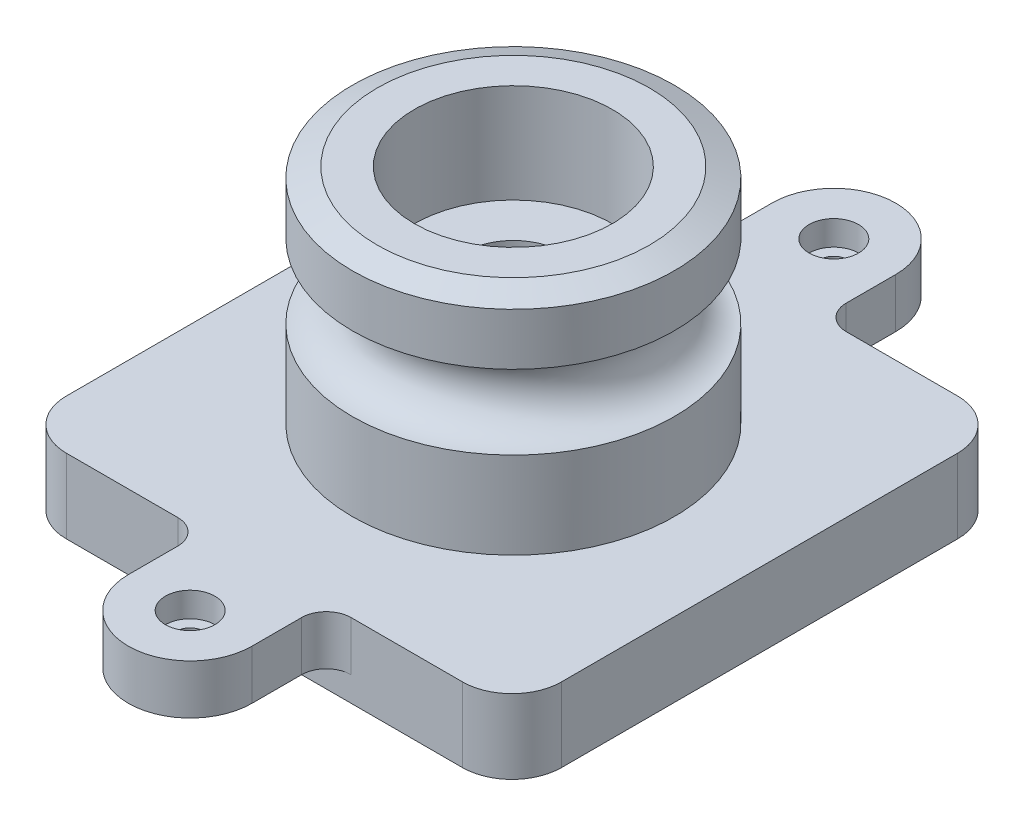
from build123d import *

# Parameters (mm, degrees)
SKETCH1_W                                    = 100
SKETCH1_H                                    = 100
BOSS_EXTRUDE1_DEPTH                          = 15
BOSS_EXTRUDE2_DEPTH                          = 10
CBORE_FOR_M5_HEX_HEAD_CAP_SCREW1_D           = 5.5
CBORE_FOR_M5_HEX_HEAD_CAP_SCREW1_CBORE_D     = 10
CBORE_FOR_M5_HEX_HEAD_CAP_SCREW1_CBORE_DEPTH = 5
FILLET1_R                                    = 5
FILLET2_R                                    = 10
CBORE_FOR_M36_HEX_HEAD_BOLT3_D               = 20
CBORE_FOR_M36_HEX_HEAD_BOLT3_CBORE_D         = 40
CBORE_FOR_M36_HEX_HEAD_BOLT3_CBORE_DEPTH     = 20
CHAMFER1_SIZE                                = 2
CHAMFER1_SIZE2                               = 5


with BuildPart() as part:
    # Sketch1 → Boss-Extrude1 (new body)
    with BuildSketch(Plane(origin=(0, 0, 0), x_dir=(1, 0, 0), z_dir=(0, 1, 0))):
        with Locations((50, 50)):
            Rectangle(SKETCH1_W, SKETCH1_H)
    extrude(amount=BOSS_EXTRUDE1_DEPTH)

    # Sketch3 → Boss-Extrude2 (add)
    with BuildSketch(Plane(origin=(0, 15, 0), x_dir=(1, 0, 0), z_dir=(0, 1, 0))):
        with BuildLine():
            Line((37.5, 100), (37.5, 115))
            ThreePointArc((37.5, 115), (50, 127.5), (62.5, 115))
            Line((62.5, 115), (62.5, 100))
            Line((62.5, 100), (37.5, 100))
        make_face()
        with BuildLine():
            Line((62.5, 0), (62.5, -15))
            ThreePointArc((62.5, -15), (50, -27.5), (37.5, -15))
            Line((37.5, -15), (37.5, 0))
            Line((37.5, 0), (62.5, 0))
        make_face()
    extrude(amount=-BOSS_EXTRUDE2_DEPTH)

    # CBORE for M5 Hex Head Cap Screw1 (through all)
    with Locations(Plane(origin=(0, 15, 0), x_dir=(1, 0, 0), z_dir=(0, 1, 0))):
        with Locations((50, 115), (50, -15)):
            CounterBoreHole(CBORE_FOR_M5_HEX_HEAD_CAP_SCREW1_D / 2, CBORE_FOR_M5_HEX_HEAD_CAP_SCREW1_CBORE_D / 2, CBORE_FOR_M5_HEX_HEAD_CAP_SCREW1_CBORE_DEPTH)

    # Fillet1
    fillet1_edges = [part.edges().sort_by_distance(p)[0] for p in [
        (62.5, 10, -100),
        (37.5, 10, -100),
        (62.5, 10, 0),
        (37.5, 10, 0),
    ]]
    fillet(fillet1_edges, radius=FILLET1_R)

    # Fillet2
    fillet2_edges = [part.edges().sort_by_distance(p)[0] for p in [
        (100, 7.5, 0),
        (100, 7.5, -100),
        (0, 7.5, 0),
        (0, 7.5, -100),
    ]]
    fillet(fillet2_edges, radius=FILLET2_R)

    # Sketch20 → Revolve1 (revolve)
    with BuildSketch(Plane(origin=(50, 0, 0), x_dir=(0, 0, -1), z_dir=(1, 0, 0))):
        with BuildLine():
            Line((50.274706486, 60), (82.774706486, 60))
            Line((82.774706486, 60), (82.774706486, 47.5))
            ThreePointArc((82.774706486, 47.5), (75.274706486, 40), (82.774706486, 32.5))
            Line((82.774706486, 32.5), (82.774706486, 15))
            Line((82.774706486, 15), (50.274706486, 15))
            Line((50.274706486, 15), (50.274706486, 60))
        make_face()
    revolve(axis=Axis((50, 60, -50.274706486), (0, -1, 0)))

    # CBORE for M36 Hex Head Bolt3 (through all)
    with Locations(Plane(origin=(50, 60, -50.274706486), x_dir=(0, 0, 1), z_dir=(0, 1, 0))):
        with Locations((0, 0)):
            CounterBoreHole(CBORE_FOR_M36_HEX_HEAD_BOLT3_D / 2, CBORE_FOR_M36_HEX_HEAD_BOLT3_CBORE_D / 2, CBORE_FOR_M36_HEX_HEAD_BOLT3_CBORE_DEPTH)

    # Chamfer1
    chamfer1_edges = [part.edges().sort_by_distance(p)[0] for p in [
        (50, 60, -17.774706486),
    ]]
    chamfer1_side = [part.faces().sort_by_distance(p)[0] for p in [
        (50, 53.75, -17.774706486),
    ]]
    chamfer(chamfer1_edges, length=CHAMFER1_SIZE, length2=CHAMFER1_SIZE2, reference=chamfer1_side[0])


solid = part.part
